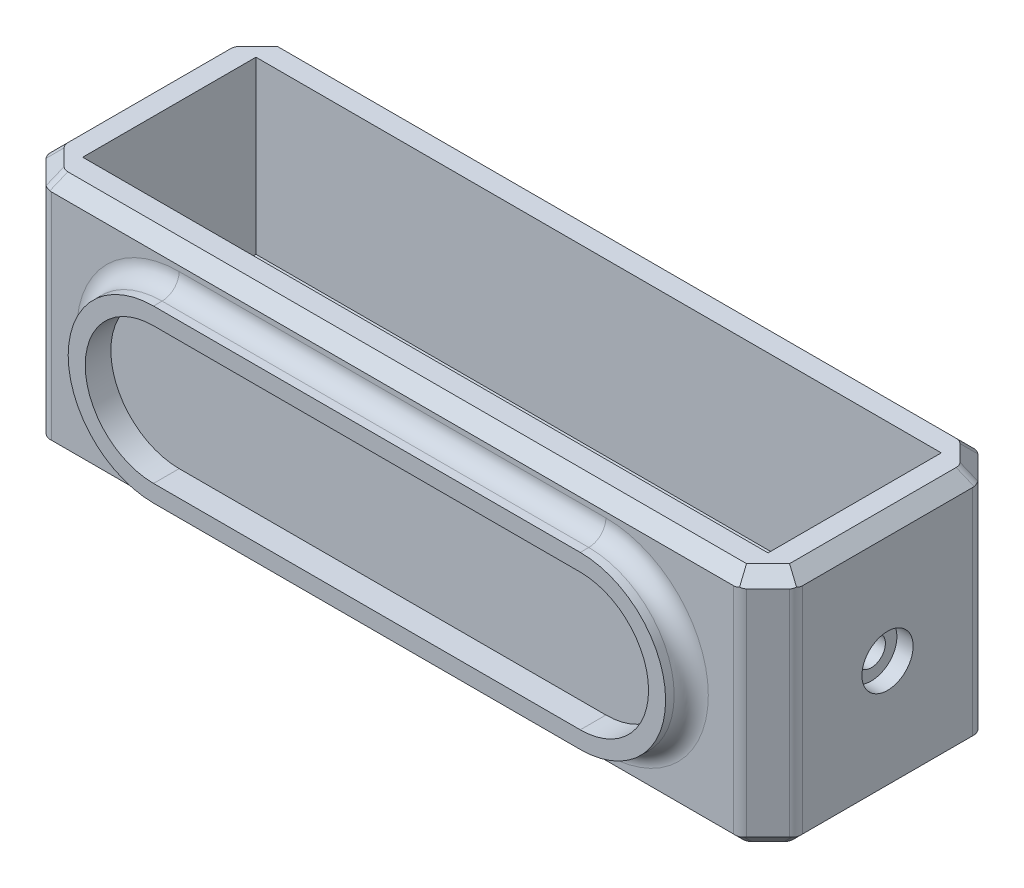
from build123d import *

# Parameters (mm, degrees)
SKETCH1_W               = 88
SKETCH1_H               = 28
BOSS_EXTRUDE1_DEPTH     = 28.2
SKETCH4_R               = 2.8
CUT_EXTRUDE1_DEPTH      = 28.2
SKETCH6_R               = 4.95
CUT_EXTRUDE2_DEPTH      = 3.2
SKETCH7_W               = 80.3
SKETCH7_H               = 20.3
CUT_EXTRUDE3_DEPTH      = 20
BOSS_EXTRUDE2_DEPTH     = 3
CHAMFER2_SIZE           = 3.4
FILLET1_R               = 2
CHAMFER3_SIZE           = 1.5
FILLET3_R               = 1.5
CHAMFER4_SIZE           = 0.75
CUT_EXTRUDE6_DEPTH      = 94.958714338
CUT_EXTRUDE6_DEPTH_BACK = 94.958714338
SKETCH11_R              = 1.65
CUT_EXTRUDE8_DEPTH      = 94.958714338
CUT_EXTRUDE8_DEPTH_BACK = 1.9
SKETCH14_R              = 3
CUT_EXTRUDE9_START      = -1.9
SKETCH15_R              = 3
CUT_EXTRUDE9_DEPTH      = 1.9


with BuildPart() as part:
    # Sketch1 → Boss-Extrude1 (new body)
    with BuildSketch(Plane(origin=(0, 0, 0), x_dir=(1, 0, 0), z_dir=(0, 1, 0))):
        Rectangle(SKETCH1_W, SKETCH1_H)
    extrude(amount=BOSS_EXTRUDE1_DEPTH)

    # Sketch4 → Cut-Extrude1 (cut)
    with BuildSketch(Plane(origin=(0, 0, 0), x_dir=(1, 0, 0), z_dir=(0, 1, 0))):
        with Locations(Location((30, 0, 0), (0, 0, 270))):
            Circle(SKETCH4_R)
        with Locations(Location((10, 0, 0), (0, 0, 270))):
            Circle(SKETCH4_R)
        with Locations(Location((-10, 0, 0), (0, 0, 270))):
            Circle(SKETCH4_R)
        with Locations(Location((-30, 0, 0), (0, 0, 270))):
            Circle(SKETCH4_R)
    extrude(amount=CUT_EXTRUDE1_DEPTH, mode=Mode.SUBTRACT)

    # Sketch6 → Cut-Extrude2 (cut)
    with BuildSketch(Plane(origin=(0, 0, 0), x_dir=(1, 0, 0), z_dir=(0, 1, 0))):
        with Locations(Location((30, 0, 0), (0, 0, 270))):
            Circle(SKETCH6_R)
        with Locations(Location((10, 0, 0), (0, 0, 270))):
            Circle(SKETCH6_R)
        with Locations(Location((-10, 0, 0), (0, 0, 270))):
            Circle(SKETCH6_R)
        with Locations(Location((-30, 0, 0), (0, 0, 270))):
            Circle(SKETCH6_R)
    extrude(amount=CUT_EXTRUDE2_DEPTH, mode=Mode.SUBTRACT)

    # Sketch7 → Cut-Extrude3 (cut)
    with BuildSketch(Plane(origin=(0, 28.2, 0), x_dir=(1, 0, 0), z_dir=(0, 1, 0))):
        Rectangle(SKETCH7_W, SKETCH7_H)
    extrude(amount=-CUT_EXTRUDE3_DEPTH, mode=Mode.SUBTRACT)

    # Sketch8 → Boss-Extrude2 (add)
    with BuildSketch(Plane.XY.offset(14)):
        with BuildLine():
            Line((-25, 24.1), (25, 24.1))
            ThreePointArc((25, 24.1), (35, 14.1), (25, 4.1))
            Line((25, 4.1), (-25, 4.1))
            ThreePointArc((-25, 4.1), (-35, 14.1), (-25, 24.1))
        make_face()
        with BuildLine():
            Line((-25, 6.1), (25, 6.1))
            ThreePointArc((25, 6.1), (33, 14.1), (25, 22.1))
            Line((25, 22.1), (-25, 22.1))
            ThreePointArc((-25, 22.1), (-33, 14.1), (-25, 6.1))
        make_face(mode=Mode.SUBTRACT)
    extrude(amount=BOSS_EXTRUDE2_DEPTH)

    # Chamfer2
    chamfer2_edges = [part.edges().sort_by_distance(p)[0] for p in [
        (-44, 14.1, -14),
        (44, 14.1, -14),
        (44, 14.1, 14),
        (-44, 14.1, 14),
    ]]
    chamfer(chamfer2_edges, length=CHAMFER2_SIZE)

    # Fillet1
    fillet1_edges = [part.edges().sort_by_distance(p)[0] for p in [
        (-35, 14.1, 14),
        (0, 4.1, 14),
        (35, 14.1, 14),
        (0, 24.1, 14),
    ]]
    fillet(fillet1_edges, radius=FILLET1_R)

    # Chamfer3
    chamfer3_edges = [part.edges().sort_by_distance(p)[0] for p in [
        (0, 0, 14),
        (0, 28.2, 14),
        (-44, 0, 0),
        (0, 0, -14),
        (44, 0, 0),
        (-42.3, 0, -12.3),
        (42.3, 0, -12.3),
        (42.3, 0, 12.3),
        (-42.3, 0, 12.3),
        (-44, 28.2, 0),
        (44, 28.2, 0),
        (0, 28.2, -14),
        (-42.3, 28.2, -12.3),
        (42.3, 28.2, -12.3),
        (42.3, 28.2, 12.3),
        (-42.3, 28.2, 12.3),
    ]]
    chamfer(chamfer3_edges, length=CHAMFER3_SIZE)

    # Fillet3
    # the kernel refuses this fillet: 1.5 mm, written as the material it takes off along each edge
    with BuildSketch(Plane(origin=(44, -0.053300859, -10.6), x_dir=(0, 0, 1), z_dir=(0, 1, 0)), Plane(origin=(40.6, -0.053300859, -14), x_dir=(0.7071067811865476, 0, 0.7071067811865476), z_dir=(0, 1, 0)), Plane(origin=(44, -0.053300859, 10.6), x_dir=(-0.707106781186546, 0, 0.7071067811865489), z_dir=(0, 1, 0)), Plane(origin=(40.6, -0.053300859, 14), x_dir=(-1, 0, 0), z_dir=(0, 1, 0))) as fillet3_piece_1:
        with BuildLine():
            CenterArc((FILLET3_R * 0.414213562373, -FILLET3_R), FILLET3_R, 90, 45)
            Line((-FILLET3_R * 0.292893218813, -FILLET3_R * 0.292893218813), (0, 0))
            Line((0, 0), (FILLET3_R * 0.414213562373, 0))
        make_face()
    extrude(amount=28.306601718, mode=Mode.SUBTRACT)
    with BuildSketch(Plane(origin=(-40.6, -0.053300859, 14), x_dir=(1, 0, 0), z_dir=(0, 1, 0)), Plane(origin=(-44, -0.053300859, 10.6), x_dir=(0.7071067811865476, 0, 0.7071067811865476), z_dir=(0, 1, 0)), Plane(origin=(-44, -0.053300859, -10.6), x_dir=(0, 0, 1), z_dir=(0, 1, 0)), Plane(origin=(-40.6, -0.053300859, -14), x_dir=(-0.7071067811865476, 0, 0.7071067811865476), z_dir=(0, 1, 0))) as fillet3_piece_2:
        with BuildLine():
            CenterArc((FILLET3_R * 0.414213562373, FILLET3_R), FILLET3_R, 225, 45)
            Line((-FILLET3_R * 0.292893218813, FILLET3_R * 0.292893218813), (0, 0))
            Line((0, 0), (FILLET3_R * 0.414213562373, 0))
        make_face()
    extrude(amount=28.306601718, mode=Mode.SUBTRACT)
    with BuildSketch(Plane(origin=(-40.896282151, 25.984711613, 14.715288387), x_dir=(0.9596829822606673, -0.19875685341551574, 0.19875685341551153), z_dir=(0.2810846377148206, 0.678598344545847, -0.678598344545847)), Plane(origin=(41.784711613, 28.915288387, -9.682397506), x_dir=(0.19875685341552204, -0.1987568534155052, 0.9596829822606672), z_dir=(0.678598344545847, -0.678598344545847, -0.2810846377148206)), Plane(origin=(39.682397506, 28.915288387, -11.784711613), x_dir=(0.8191406634032525, -0.19875685341551952, 0.5380560256884418), z_dir=(0.2810846377148208, -0.678598344545847, -0.678598344545847)), Plane(origin=(-41.784711613, -0.715288387, -9.682397506), x_dir=(-0.1987568534155126, 0.19875685341551472, 0.9596829822606672), z_dir=(-0.678598344545847, 0.678598344545847, -0.2810846377148206)), Plane(origin=(40.896282151, 2.215288387, 14.715288387), x_dir=(-0.9596829822606671, 0.1987568534155152, 0.19875685341551202), z_dir=(-0.2810846377148206, -0.678598344545847, -0.678598344545847)), Plane(origin=(-39.682397506, -0.715288387, -11.784711613), x_dir=(-0.8191406634032554, 0.19875685341551527, 0.5380560256884387), z_dir=(-0.2810846377148208, 0.678598344545847, -0.678598344545847))) as fillet3_piece_3:
        with BuildLine():
            CenterArc((FILLET3_R * 0.281084637715, FILLET3_R), FILLET3_R, 238.60028519, 31.39971481)
            Line((-FILLET3_R * 0.239920745565, FILLET3_R * 0.146446609407), (0, 0))
            Line((0, 0), (FILLET3_R * 0.281084637715, 0))
        make_face()
    extrude(amount=4.31857342, mode=Mode.SUBTRACT)
    with BuildSketch(Plane(origin=(-41.784711613, 28.915288387, 9.682397506), x_dir=(0.5380560256884337, -0.19875685341550817, 0.8191406634032606), z_dir=(-0.678598344545847, -0.678598344545847, 0.2810846377148207)), Plane(origin=(-41.784711613, 28.915288387, -9.682397506), x_dir=(-0.1987568534155052, -0.19875685341552204, 0.9596829822606672), z_dir=(-0.678598344545847, -0.678598344545847, -0.2810846377148206)), Plane(origin=(-40.896282151, 2.215288387, 14.715288387), x_dir=(0.9596829822606672, 0.1987568534155143, 0.19875685341551325), z_dir=(0.2810846377148208, -0.678598344545847, -0.678598344545847)), Plane(origin=(41.784711613, -0.715288387, 9.682397506), x_dir=(-0.5380560256884355, 0.19875685341551075, 0.8191406634032589), z_dir=(0.678598344545847, 0.678598344545847, 0.2810846377148207)), Plane(origin=(39.682397506, -0.715288387, -11.784711613), x_dir=(0.819140663403258, 0.1987568534155118, 0.5380560256884362), z_dir=(0.2810846377148208, 0.678598344545847, -0.678598344545847)), Plane(origin=(41.784711613, -0.715288387, -9.682397506), x_dir=(0.1987568534155142, 0.19875685341551314, 0.9596829822606673), z_dir=(0.678598344545847, 0.678598344545847, -0.2810846377148206))) as fillet3_piece_4:
        with BuildLine():
            CenterArc((FILLET3_R * 0.281084637715, -FILLET3_R), FILLET3_R, 90, 31.39971481)
            Line((-FILLET3_R * 0.239920745565, -FILLET3_R * 0.146446609407), (0, 0))
            Line((0, 0), (FILLET3_R * 0.281084637715, 0))
        make_face()
    extrude(amount=4.31857342, mode=Mode.SUBTRACT)

    # Chamfer4
    chamfer4_edges = [part.edges().sort_by_distance(p)[0] for p in [
        (30, 0, -4.95),
        (10, 0, -4.95),
        (-10, 0, -4.95),
        (-30, 0, -4.95),
    ]]
    chamfer(chamfer4_edges, length=CHAMFER4_SIZE)

    # Sketch11 → Cut-Extrude6 (cut, two sides: drawn at the far end of the back side and taken through both)
    with BuildSketch(Plane(origin=(44, 0, 0), x_dir=(0, 0, -1), z_dir=(1, 0, 0)).offset(-CUT_EXTRUDE6_DEPTH_BACK)):
        with Locations((0, 14.1)):
            Circle(SKETCH11_R)
    extrude(amount=CUT_EXTRUDE6_DEPTH + CUT_EXTRUDE6_DEPTH_BACK, mode=Mode.SUBTRACT)

    # Sketch14 → Cut-Extrude8 (cut, two sides: drawn at the far end of the back side and taken through both)
    with BuildSketch(Plane(origin=(44, 0, 0), x_dir=(0, 0, -1), z_dir=(1, 0, 0)).offset(-CUT_EXTRUDE8_DEPTH_BACK)):
        with Locations(Location((0, 14.1, 0), (0, 0, 180))):
            Circle(SKETCH14_R)
    extrude(amount=CUT_EXTRUDE8_DEPTH + CUT_EXTRUDE8_DEPTH_BACK, mode=Mode.SUBTRACT)

    # Sketch15 → Cut-Extrude9 (cut)
    with BuildSketch(Plane.ZY.offset(44).offset(CUT_EXTRUDE9_START)):
        with Locations((0, 14.1)):
            Circle(SKETCH15_R)
    extrude(amount=CUT_EXTRUDE9_DEPTH, mode=Mode.SUBTRACT)


solid = part.part
